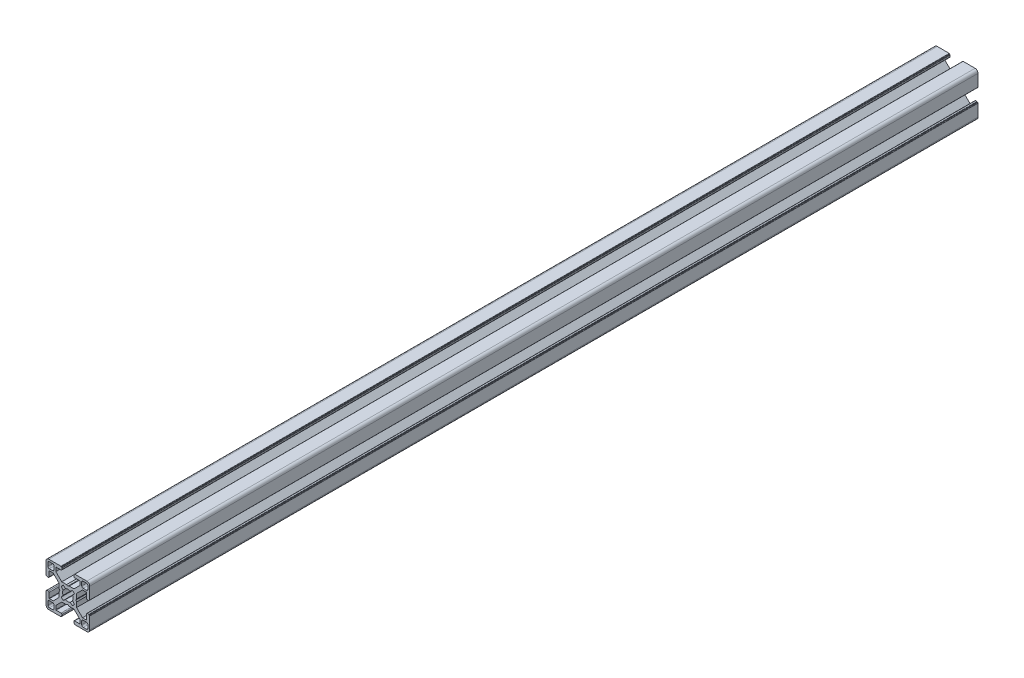
from build123d import *

# Parameters (mm, degrees)
BOSS_EXTRUDE1_DEPTH = 609.6


with BuildPart() as part:
    # Sketch1 → Boss-Extrude1 (new body)
    with BuildSketch(Plane.XY):
        with BuildLine():
            Line((6.00446543, 0.899999619), (5.484852164, 0))
            Line((5.484852164, 0), (6.00446543, -0.899999619))
            Line((6.00446543, -0.899999619), (6.00446543, -4.204465866))
            Line((6.00446543, -4.204465866), (10.049999564, -8.25))
            Line((10.049999564, -8.25), (12.59999928, -8.25))
            ThreePointArc((12.59999928, -8.25), (12.741420837, -8.191421273), (12.799999564, -8.049999716))
            Line((12.799999564, -8.049999716), (12.799999564, -4.649999613))
            ThreePointArc((12.799999564, -4.649999613), (12.975735606, -4.225735278), (13.39999994, -4.049999237))
            Line((13.39999994, -4.049999237), (14.300000043, -4.049999237))
            ThreePointArc((14.300000043, -4.049999237), (14.4414216, -4.108577964), (14.500000327, -4.249999521))
            Line((14.500000327, -4.249999521), (14.500000327, -4.349998953))
            ThreePointArc((14.500000327, -4.349998953), (14.558579054, -4.49142051), (14.700000611, -4.549999237))
            Line((14.700000611, -4.549999237), (14.799999716, -4.549999237))
            ThreePointArc((14.799999716, -4.549999237), (14.941421273, -4.608577964), (15, -4.749999521))
            Line((15, -4.749999521), (15, -13.000000346))
            ThreePointArc((15, -13.000000346), (14.414213664, -14.414213664), (13.000000346, -15))
            Line((13.000000346, -15), (4.749999945, -15))
            ThreePointArc((4.749999945, -15), (4.60857832, -14.941421245), (4.549999564, -14.799999619))
            Line((4.549999564, -14.799999619), (4.549999564, -14.69999942))
            ThreePointArc((4.549999564, -14.69999942), (4.49142109, -14.558578474), (4.350000144, -14.5))
            Line((4.350000144, -14.5), (4.250000374, -14.5))
            ThreePointArc((4.250000374, -14.5), (4.108578753, -14.441421247), (4.05, -14.299999626))
            Line((4.05, -14.299999626), (4.05, -13.399999434))
            ThreePointArc((4.05, -13.399999434), (4.225735989, -12.975735226), (4.650000197, -12.799999237))
            Line((4.650000197, -12.799999237), (8.049999924, -12.799999237))
            ThreePointArc((8.049999924, -12.799999237), (8.191421565, -12.741420475), (8.250000327, -12.599998834))
            Line((8.250000327, -12.599998834), (8.250000327, -10.049999237))
            Line((8.250000327, -10.049999237), (4.204466193, -6))
            Line((4.204466193, -6), (0.899999946, -6))
            Line((0.899999946, -6), (0, -5.484851837))
            Line((0, -5.484851837), (-0.899999946, -6))
            Line((-0.899999946, -6), (-4.204466193, -6))
            Line((-4.204466193, -6), (-8.250000327, -10.049999237))
            Line((-8.250000327, -10.049999237), (-8.250000327, -12.599998834))
            ThreePointArc((-8.250000327, -12.599998834), (-8.191421565, -12.741420475), (-8.049999924, -12.799999237))
            Line((-8.049999924, -12.799999237), (-4.650000197, -12.799999237))
            ThreePointArc((-4.650000197, -12.799999237), (-4.225735989, -12.975735226), (-4.05, -13.399999434))
            Line((-4.05, -13.399999434), (-4.05, -14.299999626))
            ThreePointArc((-4.05, -14.299999626), (-4.108578753, -14.441421247), (-4.250000374, -14.5))
            Line((-4.250000374, -14.5), (-4.350000144, -14.5))
            ThreePointArc((-4.350000144, -14.5), (-4.49142109, -14.558578474), (-4.549999564, -14.69999942))
            Line((-4.549999564, -14.69999942), (-4.549999564, -14.799999619))
            ThreePointArc((-4.549999564, -14.799999619), (-4.60857832, -14.941421245), (-4.749999945, -15))
            Line((-4.749999945, -15), (-13.000000346, -15))
            ThreePointArc((-13.000000346, -15), (-14.414213664, -14.414213664), (-15, -13.000000346))
            Line((-15, -13.000000346), (-15, -4.749999521))
            ThreePointArc((-15, -4.749999521), (-14.941421273, -4.608577964), (-14.799999716, -4.549999237))
            Line((-14.799999716, -4.549999237), (-14.700000611, -4.549999237))
            ThreePointArc((-14.700000611, -4.549999237), (-14.558579054, -4.49142051), (-14.500000327, -4.349998953))
            Line((-14.500000327, -4.349998953), (-14.500000327, -4.249999521))
            ThreePointArc((-14.500000327, -4.249999521), (-14.4414216, -4.108577964), (-14.300000043, -4.049999237))
            Line((-14.300000043, -4.049999237), (-13.39999994, -4.049999237))
            ThreePointArc((-13.39999994, -4.049999237), (-12.975735606, -4.225735278), (-12.799999564, -4.649999613))
            Line((-12.799999564, -4.649999613), (-12.799999564, -8.049999716))
            ThreePointArc((-12.799999564, -8.049999716), (-12.741420837, -8.191421273), (-12.59999928, -8.25))
            Line((-12.59999928, -8.25), (-10.049999564, -8.25))
            Line((-10.049999564, -8.25), (-6.00446543, -4.204465866))
            Line((-6.00446543, -4.204465866), (-6.00446543, -0.899999619))
            Line((-6.00446543, -0.899999619), (-5.484852164, 0))
            Line((-5.484852164, 0), (-6.00446543, 0.899999619))
            Line((-6.00446543, 0.899999619), (-6.00446543, 4.204465866))
            Line((-6.00446543, 4.204465866), (-10.049999564, 8.25))
            Line((-10.049999564, 8.25), (-12.59999928, 8.25))
            ThreePointArc((-12.59999928, 8.25), (-12.741420837, 8.191421273), (-12.799999564, 8.049999716))
            Line((-12.799999564, 8.049999716), (-12.799999564, 4.649999613))
            ThreePointArc((-12.799999564, 4.649999613), (-12.975735606, 4.225735278), (-13.39999994, 4.049999237))
            Line((-13.39999994, 4.049999237), (-14.300000043, 4.049999237))
            ThreePointArc((-14.300000043, 4.049999237), (-14.4414216, 4.108577964), (-14.500000327, 4.249999521))
            Line((-14.500000327, 4.249999521), (-14.500000327, 4.349998953))
            ThreePointArc((-14.500000327, 4.349998953), (-14.558579054, 4.49142051), (-14.700000611, 4.549999237))
            Line((-14.700000611, 4.549999237), (-14.799999716, 4.549999237))
            ThreePointArc((-14.799999716, 4.549999237), (-14.941421273, 4.608577964), (-15, 4.749999521))
            Line((-15, 4.749999521), (-15, 13.000000346))
            ThreePointArc((-15, 13.000000346), (-14.414213664, 14.414213664), (-13.000000346, 15))
            Line((-13.000000346, 15), (-4.749999945, 15))
            ThreePointArc((-4.749999945, 15), (-4.60857832, 14.941421245), (-4.549999564, 14.799999619))
            Line((-4.549999564, 14.799999619), (-4.549999564, 14.69999942))
            ThreePointArc((-4.549999564, 14.69999942), (-4.49142109, 14.558578474), (-4.350000144, 14.5))
            Line((-4.350000144, 14.5), (-4.250000374, 14.5))
            ThreePointArc((-4.250000374, 14.5), (-4.108578753, 14.441421247), (-4.05, 14.299999626))
            Line((-4.05, 14.299999626), (-4.05, 13.399999434))
            ThreePointArc((-4.05, 13.399999434), (-4.225735989, 12.975735226), (-4.650000197, 12.799999237))
            Line((-4.650000197, 12.799999237), (-8.049999924, 12.799999237))
            ThreePointArc((-8.049999924, 12.799999237), (-8.191421565, 12.741420475), (-8.250000327, 12.599998834))
            Line((-8.250000327, 12.599998834), (-8.250000327, 10.049999237))
            Line((-8.250000327, 10.049999237), (-4.204466193, 6))
            Line((-4.204466193, 6), (-0.899999946, 6))
            Line((-0.899999946, 6), (0, 5.484851837))
            Line((0, 5.484851837), (0.899999946, 6))
            Line((0.899999946, 6), (4.204466193, 6))
            Line((4.204466193, 6), (8.250000327, 10.049999237))
            Line((8.250000327, 10.049999237), (8.250000327, 12.599998834))
            ThreePointArc((8.250000327, 12.599998834), (8.191421565, 12.741420475), (8.049999924, 12.799999237))
            Line((8.049999924, 12.799999237), (4.650000197, 12.799999237))
            ThreePointArc((4.650000197, 12.799999237), (4.225735989, 12.975735226), (4.05, 13.399999434))
            Line((4.05, 13.399999434), (4.05, 14.299999626))
            ThreePointArc((4.05, 14.299999626), (4.108578753, 14.441421247), (4.250000374, 14.5))
            Line((4.250000374, 14.5), (4.350000144, 14.5))
            ThreePointArc((4.350000144, 14.5), (4.49142109, 14.558578474), (4.549999564, 14.69999942))
            Line((4.549999564, 14.69999942), (4.549999564, 14.799999619))
            ThreePointArc((4.549999564, 14.799999619), (4.60857832, 14.941421245), (4.749999945, 15))
            Line((4.749999945, 15), (13.000000346, 15))
            ThreePointArc((13.000000346, 15), (14.414213664, 14.414213664), (15, 13.000000346))
            Line((15, 13.000000346), (15, 4.749999521))
            ThreePointArc((15, 4.749999521), (14.941421273, 4.608577964), (14.799999716, 4.549999237))
            Line((14.799999716, 4.549999237), (14.700000611, 4.549999237))
            ThreePointArc((14.700000611, 4.549999237), (14.558579054, 4.49142051), (14.500000327, 4.349998953))
            Line((14.500000327, 4.349998953), (14.500000327, 4.249999521))
            ThreePointArc((14.500000327, 4.249999521), (14.4414216, 4.108577964), (14.300000043, 4.049999237))
            Line((14.300000043, 4.049999237), (13.39999994, 4.049999237))
            ThreePointArc((13.39999994, 4.049999237), (12.975735606, 4.225735278), (12.799999564, 4.649999613))
            Line((12.799999564, 4.649999613), (12.799999564, 8.049999716))
            ThreePointArc((12.799999564, 8.049999716), (12.741420837, 8.191421273), (12.59999928, 8.25))
            Line((12.59999928, 8.25), (10.049999564, 8.25))
            Line((10.049999564, 8.25), (6.00446543, 4.204465866))
            Line((6.00446543, 4.204465866), (6.00446543, 0.899999619))
        make_face()
        with BuildLine():
            Line((13.70000109, 12.700000398), (13.70000109, 10.499999635))
            ThreePointArc((13.70000109, 10.499999635), (13.407107874, 9.792892851), (12.70000109, 9.499999635))
            Line((12.70000109, 9.499999635), (10.500000327, 9.499999635))
            ThreePointArc((10.500000327, 9.499999635), (9.792893543, 9.792892851), (9.500000327, 10.499999635))
            Line((9.500000327, 10.499999635), (9.500000327, 12.700000398))
            ThreePointArc((9.500000327, 12.700000398), (9.792893543, 13.407107182), (10.500000327, 13.700000398))
            Line((10.500000327, 13.700000398), (12.70000109, 13.700000398))
            ThreePointArc((12.70000109, 13.700000398), (13.407107874, 13.407107182), (13.70000109, 12.700000398))
        make_face(mode=Mode.SUBTRACT)
        with BuildLine():
            Line((3.135929412, 4.518400903), (1.600129524, 3.280561767))
            ThreePointArc((1.600129524, 3.280561767), (0, 3.65), (-1.600129524, 3.280561767))
            Line((-1.600129524, 3.280561767), (-3.135929412, 4.518400903))
            ThreePointArc((-3.135929412, 4.518400903), (-3.881002259, 3.897155561), (-4.505336892, 3.154669473))
            Line((-4.505336892, 3.154669473), (-3.280561732, 1.600129597))
            ThreePointArc((-3.280561732, 1.600129597), (-3.65, 0), (-3.280561732, -1.600129597))
            Line((-3.280561732, -1.600129597), (-4.505336892, -3.154669473))
            ThreePointArc((-4.505336892, -3.154669473), (-3.881002259, -3.897155561), (-3.135929412, -4.518400903))
            Line((-3.135929412, -4.518400903), (-1.600129524, -3.280561767))
            ThreePointArc((-1.600129524, -3.280561767), (0, -3.65), (1.600129524, -3.280561767))
            Line((1.600129524, -3.280561767), (3.135929412, -4.518400903))
            ThreePointArc((3.135929412, -4.518400903), (3.881002259, -3.897155561), (4.505336892, -3.154669473))
            Line((4.505336892, -3.154669473), (3.280561732, -1.600129597))
            ThreePointArc((3.280561732, -1.600129597), (3.65, 0), (3.280561732, 1.600129597))
            Line((3.280561732, 1.600129597), (4.505336892, 3.154669473))
            ThreePointArc((4.505336892, 3.154669473), (3.881002259, 3.897155561), (3.135929412, 4.518400903))
        make_face(mode=Mode.SUBTRACT)
        with BuildLine():
            Line((-13.70000109, -12.700000398), (-13.70000109, -10.499999635))
            ThreePointArc((-13.70000109, -10.499999635), (-13.407107874, -9.792892851), (-12.70000109, -9.499999635))
            Line((-12.70000109, -9.499999635), (-10.500000327, -9.499999635))
            ThreePointArc((-10.500000327, -9.499999635), (-9.792893543, -9.792892851), (-9.500000327, -10.499999635))
            Line((-9.500000327, -10.499999635), (-9.500000327, -12.700000398))
            ThreePointArc((-9.500000327, -12.700000398), (-9.792893543, -13.407107182), (-10.500000327, -13.700000398))
            Line((-10.500000327, -13.700000398), (-12.70000109, -13.700000398))
            ThreePointArc((-12.70000109, -13.700000398), (-13.407107874, -13.407107182), (-13.70000109, -12.700000398))
        make_face(mode=Mode.SUBTRACT)
        with BuildLine():
            Line((10.500000327, -13.700000398), (12.70000109, -13.700000398))
            ThreePointArc((12.70000109, -13.700000398), (13.407107874, -13.407107182), (13.70000109, -12.700000398))
            Line((13.70000109, -12.700000398), (13.70000109, -10.499999635))
            ThreePointArc((13.70000109, -10.499999635), (13.407107874, -9.792892851), (12.70000109, -9.499999635))
            Line((12.70000109, -9.499999635), (10.500000327, -9.499999635))
            ThreePointArc((10.500000327, -9.499999635), (9.792893543, -9.792892851), (9.500000327, -10.499999635))
            Line((9.500000327, -10.499999635), (9.500000327, -12.700000398))
            ThreePointArc((9.500000327, -12.700000398), (9.792893543, -13.407107182), (10.500000327, -13.700000398))
        make_face(mode=Mode.SUBTRACT)
        with BuildLine():
            Line((-10.500000327, 13.700000398), (-12.70000109, 13.700000398))
            ThreePointArc((-12.70000109, 13.700000398), (-13.407107874, 13.407107182), (-13.70000109, 12.700000398))
            Line((-13.70000109, 12.700000398), (-13.70000109, 10.499999635))
            ThreePointArc((-13.70000109, 10.499999635), (-13.407107874, 9.792892851), (-12.70000109, 9.499999635))
            Line((-12.70000109, 9.499999635), (-10.500000327, 9.499999635))
            ThreePointArc((-10.500000327, 9.499999635), (-9.792893543, 9.792892851), (-9.500000327, 10.499999635))
            Line((-9.500000327, 10.499999635), (-9.500000327, 12.700000398))
            ThreePointArc((-9.500000327, 12.700000398), (-9.792893543, 13.407107182), (-10.500000327, 13.700000398))
        make_face(mode=Mode.SUBTRACT)
    extrude(amount=BOSS_EXTRUDE1_DEPTH)


solid = part.part
